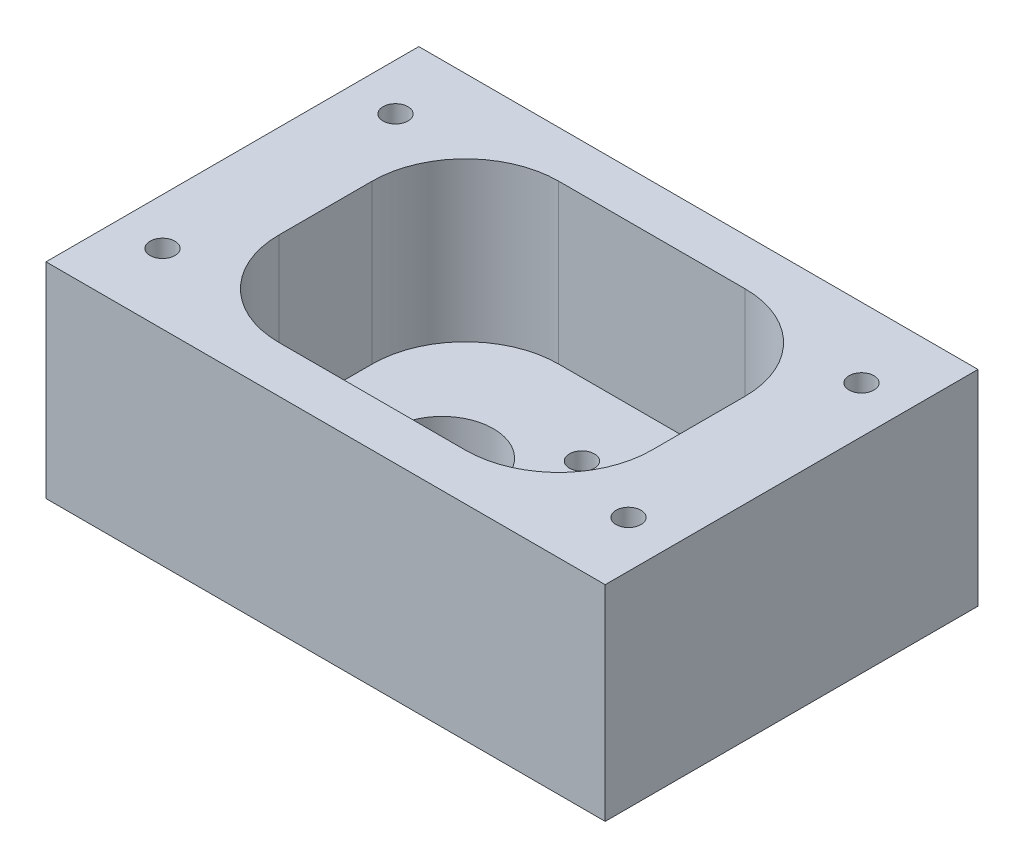
from build123d import *

# Parameters (mm, degrees)
SKETCH1_W            = 76.2
SKETCH1_H            = 50.8
BOSS_EXTRUDE1_DEPTH  = 27.94
SKETCH2_R            = 6.985
SKETCH2_R_2          = 9
CUT_EXTRUDE1_DEPTH   = 54.641528688
CUT_EXTRUDE2_DEPTH   = 21.59
M3_CLEARANCE_HOLE1_D = 3.4


with BuildPart() as part:
    # Sketch1 → Boss-Extrude1 (new body)
    with BuildSketch(Plane(origin=(0, 0, 0), x_dir=(1, 0, 0), z_dir=(0, 1, 0))):
        Rectangle(SKETCH1_W, SKETCH1_H)
    extrude(amount=BOSS_EXTRUDE1_DEPTH)

    # Sketch2 → Cut-Extrude1 (cut, through all)
    with BuildSketch(Plane.XZ):
        with Locations((-9.525, 0)):
            Circle(SKETCH2_R)
        with Locations((9.525, 0)):
            Circle(SKETCH2_R_2)
    extrude(amount=-CUT_EXTRUDE1_DEPTH, mode=Mode.SUBTRACT)

    # Sketch3 → Cut-Extrude2 (cut)
    with BuildSketch(Plane(origin=(0, 27.94, 0), x_dir=(1, 0, 0), z_dir=(0, 1, 0))):
        with BuildLine():
            Line((-12.7, -19.05), (12.7, -19.05))
            ThreePointArc((12.7, -19.05), (21.680256121, -15.330256121), (25.4, -6.35))
            Line((25.4, -6.35), (25.4, 6.35))
            ThreePointArc((25.4, 6.35), (21.680256121, 15.330256121), (12.7, 19.05))
            Line((12.7, 19.05), (-12.7, 19.05))
            ThreePointArc((-12.7, 19.05), (-21.680256121, 15.330256121), (-25.4, 6.35))
            Line((-25.4, 6.35), (-25.4, -6.35))
            ThreePointArc((-25.4, -6.35), (-21.680256121, -15.330256121), (-12.7, -19.05))
        make_face()
    extrude(amount=-CUT_EXTRUDE2_DEPTH, mode=Mode.SUBTRACT)

    # M3 Clearance Hole1 (through all)
    with Locations(Plane(origin=(-31.75, 0, 15.875), x_dir=(0, 0, -1), z_dir=(0, -1, 0))):
        with Locations((0, 0), (31.75, 0), (6.682611845, 32.082611845), (25.067388155, 32.082611845), (6.682611845, 50.467388155), (25.067388155, 50.467388155), (0, 63.5), (31.75, 63.5)):
            Hole(M3_CLEARANCE_HOLE1_D / 2)


solid = part.part
